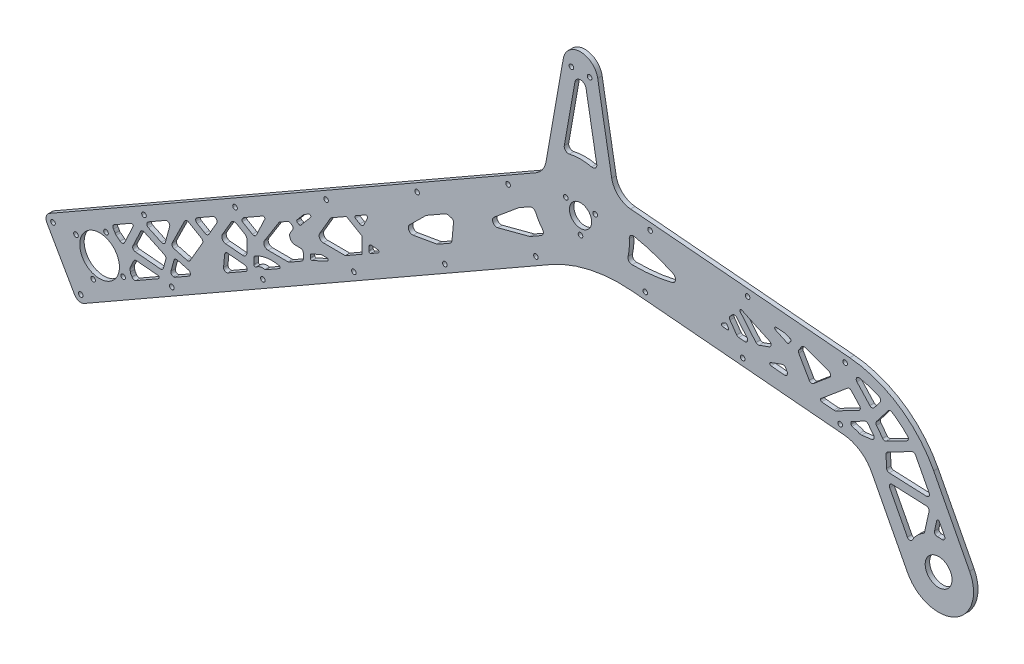
from build123d import *

# Parameters (mm, degrees)
SKETCH2_R              = 7.9375
SKETCH2_R_2            = 14.2
SKETCH2_R_3            = 1.65
SKETCH2_R_4            = 9.5885
BASE_DEPTH             = 3.175
SKETCH3_R              = 1.65
STRUT_HOLES_DEPTH      = 448.434897902
LIGHTENING_HOLES_DEPTH = 448.434897902
SKETCH7_R              = 1.65
CUT_EXTRUDE1_DEPTH     = 448.434897902


with BuildPart() as part:
    # Sketch2 → Base (new body)
    with BuildSketch(Plane.XY):
        with BuildLine():
            Line((-379.716809958, -188.506893436), (-32.006532147, 10.487277971))
            ThreePointArc((-32.006532147, 10.487277971), (-27.186230121, 14.879084252), (-24.685038782, 20.901319377))
            Line((-24.685038782, 20.901319377), (-12.310096913, 91.083102221))
            ThreePointArc((-12.310096913, 91.083102221), (0, 101.4125), (12.310096913, 91.083102221))
            Line((12.310096913, 91.083102221), (22.322003955, 34.302755831))
            ThreePointArc((22.322003955, 34.302755831), (26.960267136, 25.848318444), (35.786784109, 21.964558025))
            Line((35.786784109, 21.964558025), (192.586144941, 8.246391504))
            ThreePointArc((192.586144941, 8.246391504), (227.717231711, -4.10798993), (252.575276723, -31.83706486))
            Line((252.575276723, -31.83706486), (278.255270829, -81.167874559))
            ThreePointArc((278.255270829, -81.167874559), (267.623715331, -114.886860719), (233.904729171, -104.255305221))
            Line((233.904729171, -104.255305221), (208.224735064, -54.924495522))
            ThreePointArc((208.224735064, -54.924495522), (199.93872006, -45.681470545), (188.228357804, -41.563343401))
            Line((188.228357804, -41.563343401), (36.823729736, -28.317154839))
            ThreePointArc((36.823729736, -28.317154839), (6.649577682, -30.266109959), (-21.562664076, -41.144864173))
            Line((-21.562664076, -41.144864173), (-354.881400189, -231.902773674))
            ThreePointArc((-354.881400189, -231.902773674), (-358.677364619, -232.387866435), (-361.70452919, -230.046726627))
            Line((-361.70452919, -230.046726627), (-381.572857005, -195.330022437))
            ThreePointArc((-381.572857005, -195.330022437), (-382.057949767, -191.534058007), (-379.716809958, -188.506893436))
        make_face()
        Circle(SKETCH2_R, mode=Mode.SUBTRACT)
        with Locations((-343.92, -196.825)):
            Circle(SKETCH2_R_2, mode=Mode.SUBTRACT)
        with Locations((-6.5, 88.9125)):
            Circle(SKETCH2_R_3, mode=Mode.SUBTRACT)
        with Locations((6.5, 88.9125)):
            Circle(SKETCH2_R_3, mode=Mode.SUBTRACT)
        with Locations((256.08, -92.71158989)):
            Circle(SKETCH2_R_4, mode=Mode.SUBTRACT)
        with Locations((-360.806382749, -192.231517914)):
            Circle(SKETCH2_R_3, mode=Mode.SUBTRACT)
        with Locations((-339.326517914, -179.938617251)):
            Circle(SKETCH2_R_3, mode=Mode.SUBTRACT)
        with Locations((-327.033617251, -201.418482086)):
            Circle(SKETCH2_R_3, mode=Mode.SUBTRACT)
        with Locations((-348.513482086, -213.711382749)):
            Circle(SKETCH2_R_3, mode=Mode.SUBTRACT)
    extrude(amount=BASE_DEPTH)

    # Sketch3 → Strut Holes (cut, through all)
    with BuildSketch(Plane.XY.offset(3.175)):
        with Locations((-357.364941166, -227.56318565)):
            Circle(SKETCH3_R)
        with Locations((-292.27112081, -190.310070996)):
            Circle(SKETCH3_R)
        with Locations((-227.177300453, -153.056956343)):
            Circle(SKETCH3_R)
        with Locations((-162.083480097, -115.803841689)):
            Circle(SKETCH3_R)
        with Locations((-96.98965974, -78.550727035)):
            Circle(SKETCH3_R)
        with Locations((-31.895839384, -41.297612382)):
            Circle(SKETCH3_R)
        with Locations((-312.139448625, -155.593366806)):
            Circle(SKETCH3_R)
        with Locations((-377.233268981, -192.84648146)):
            Circle(SKETCH3_R)
        with Locations((-247.045628268, -118.340252152)):
            Circle(SKETCH3_R)
        with Locations((-181.951807912, -81.087137499)):
            Circle(SKETCH3_R)
        with Locations((-116.857987555, -43.834022845)):
            Circle(SKETCH3_R)
        with Locations((-51.764167199, -6.580908192)):
            Circle(SKETCH3_R)
        with Locations((46.269308527, -24.124436716)):
            Circle(SKETCH3_R)
        with Locations((116.002937393, -30.225338708)):
            Circle(SKETCH3_R)
        with Locations((185.73656626, -36.326240701)):
            Circle(SKETCH3_R)
        with Locations((189.222795969, 3.521547223)):
            Circle(SKETCH3_R)
        with Locations((119.489167103, 9.622449215)):
            Circle(SKETCH3_R)
        with Locations((49.755538237, 15.723351208)):
            Circle(SKETCH3_R)
    extrude(amount=-STRUT_HOLES_DEPTH, mode=Mode.SUBTRACT)

    # Sketch6 → Lightening Holes (cut, through all)
    with BuildSketch(Plane.XY.offset(3.175)):
        with BuildLine():
            Line((-317.937082153, -199.237754107), (-301.759255291, -189.979203363))
            ThreePointArc((-301.759255291, -189.979203363), (-301.27885272, -188.89855459), (-302.165025934, -188.115429161))
            Line((-302.165025934, -188.115429161), (-317.529091672, -186.71244549))
            ThreePointArc((-317.529091672, -186.71244549), (-318.704383169, -186.968323474), (-319.520360019, -187.852045956))
            Line((-319.520360019, -187.852045956), (-321.920665487, -192.94890269))
            ThreePointArc((-321.920665487, -192.94890269), (-322.086706026, -193.488507205), (-322.095332893, -194.053014132))
            ThreePointArc((-322.095332893, -194.053014132), (-321.995430567, -195.004765075), (-321.937013257, -195.959960211))
            ThreePointArc((-321.937013257, -195.959960211), (-321.816611469, -196.56901374), (-321.515239324, -197.111800643))
            ThreePointArc((-321.515239324, -197.111800643), (-321.089709213, -197.721191561), (-320.73119159, -198.372266273))
            ThreePointArc((-320.73119159, -198.372266273), (-319.522268091, -199.412366176), (-317.937082153, -199.237754107))
        make_face()
        with BuildLine():
            Line((-289.844978396, -183.160677107), (-279.93882887, -177.491399715))
            ThreePointArc((-279.93882887, -177.491399715), (-278.948378644, -175.502042811), (-280.407275879, -173.825692191))
            Line((-280.407275879, -173.825692191), (-288.292322007, -171.680779414))
            ThreePointArc((-288.292322007, -171.680779414), (-289.810707779, -171.874816518), (-290.747163702, -173.085682346))
            Line((-290.747163702, -173.085682346), (-292.868560549, -180.884280112))
            ThreePointArc((-292.868560549, -180.884280112), (-292.613471256, -182.502456625), (-291.234784363, -183.387209827))
            ThreePointArc((-291.234784363, -183.387209827), (-291.195764259, -183.393163574), (-291.156778347, -183.399337252))
            ThreePointArc((-291.156778347, -183.399337252), (-290.480404568, -183.392541824), (-289.844978396, -183.160677107))
        make_face()
        with BuildLine():
            Line((-225.068253149, -146.0890356), (-215.394271166, -140.552627413))
            ThreePointArc((-215.394271166, -140.552627413), (-214.903636001, -139.526112554), (-215.691072999, -138.704894803))
            ThreePointArc((-215.691072999, -138.704894803), (-224.321295756, -138.46558821), (-232.518295989, -141.176160044))
            ThreePointArc((-232.518295989, -141.176160044), (-233.286477009, -141.90836482), (-233.571916458, -142.930495063))
            Line((-233.571916458, -142.930495063), (-233.587977081, -147.160409637))
            ThreePointArc((-233.587977081, -147.160409637), (-232.992005427, -148.078956173), (-231.91164881, -147.900800252))
            ThreePointArc((-231.91164881, -147.900800252), (-229.043893867, -146.310414337), (-225.766503733, -146.200597789))
            ThreePointArc((-225.766503733, -146.200597789), (-225.407188584, -146.208593442), (-225.068253149, -146.0890356))
        make_face()
        with BuildLine():
            Line((-202.450189496, -105.529322903), (-201.311100417, -106.192755657))
            ThreePointArc((-201.311100417, -106.192755657), (-200.637908098, -106.314094916), (-200.044217491, -105.974326499))
            Line((-200.044217491, -105.974326499), (-193.10874934, -97.772404377))
            ThreePointArc((-193.10874934, -97.772404377), (-193.103868157, -96.486838424), (-194.369055865, -96.258795212))
            Line((-194.369055865, -96.258795212), (-197.510306407, -98.056529098))
            ThreePointArc((-197.510306407, -98.056529098), (-197.796638801, -98.255405281), (-198.044086675, -98.500981186))
            Line((-198.044086675, -98.500981186), (-202.710503229, -104.019510625))
            ThreePointArc((-202.710503229, -104.019510625), (-202.932364876, -104.835109908), (-202.450189496, -105.529322903))
        make_face()
        with BuildLine():
            Line((-333.444620565, -172.395023354), (-321.324736547, -165.45882839))
            ThreePointArc((-321.324736547, -165.45882839), (-320.149643655, -165.592039112), (-319.923331731, -166.752802359))
            Line((-319.923331731, -166.752802359), (-326.076688787, -179.818964042))
            ThreePointArc((-326.076688787, -179.818964042), (-327.489682534, -180.927174615), (-329.222241859, -180.455030372))
            ThreePointArc((-329.222241859, -180.455030372), (-330.587096563, -179.325466122), (-332.03841525, -178.309386485))
            ThreePointArc((-332.03841525, -178.309386485), (-332.502552417, -177.897052298), (-332.817881567, -177.362252973))
            ThreePointArc((-332.817881567, -177.362252973), (-333.319567754, -176.344657072), (-333.979051672, -175.421471605))
            ThreePointArc((-333.979051672, -175.421471605), (-334.420732076, -173.783065742), (-333.444620565, -172.395023354))
        make_face()
        with BuildLine():
            Line((-296.526078791, -175.281178461), (-298.296173769, -181.788333758))
            ThreePointArc((-298.296173769, -181.788333758), (-299.085121934, -182.906012266), (-300.407921189, -183.255077571))
            Line((-300.407921189, -183.255077571), (-318.426512518, -181.609693475))
            ThreePointArc((-318.426512518, -181.609693475), (-319.980472622, -180.611396672), (-320.054030653, -178.765867554))
            Line((-320.054030653, -178.765867554), (-314.587930437, -167.159040818))
            ThreePointArc((-314.587930437, -167.159040818), (-313.455436739, -166.129184627), (-311.926424469, -166.201760304))
            Line((-311.926424469, -166.201760304), (-297.603838378, -172.946815839))
            ThreePointArc((-297.603838378, -172.946815839), (-296.64013933, -173.917860945), (-296.526078791, -175.281178461))
        make_face()
        with BuildLine():
            Line((-296.725202345, -151.380544722), (-309.162121937, -158.49817876))
            ThreePointArc((-309.162121937, -158.49817876), (-310.167118822, -160.31366557), (-309.020818273, -162.043407211))
            Line((-309.020818273, -162.043407211), (-299.712508239, -166.427047688))
            ThreePointArc((-299.712508239, -166.427047688), (-298.022047377, -166.433466223), (-296.930523197, -165.142623828))
            Line((-296.930523197, -165.142623828), (-293.80191364, -153.641349312))
            ThreePointArc((-293.80191364, -153.641349312), (-294.508247327, -151.534307484), (-296.725202345, -151.380544722))
        make_face()
        with BuildLine():
            Line((-290.749203903, -165.830761417), (-281.418682259, -168.368876575))
            ThreePointArc((-281.418682259, -168.368876575), (-280.135367262, -168.289656018), (-279.165471442, -167.445573454))
            Line((-279.165471442, -167.445573454), (-270.334962051, -152.283921043))
            ThreePointArc((-270.334962051, -152.283921043), (-270.129400346, -150.767052513), (-271.056634293, -149.549110414))
            Line((-271.056634293, -149.549110414), (-280.339031078, -144.142820271))
            ThreePointArc((-280.339031078, -144.142820271), (-281.923077504, -143.956245777), (-283.139846515, -144.987500494))
            Line((-283.139846515, -144.987500494), (-292.018480766, -163.01732789))
            ThreePointArc((-292.018480766, -163.01732789), (-292.047293032, -164.72335957), (-290.749203903, -165.830761417))
        make_face()
        with BuildLine():
            Line((-274.174863713, -138.475013199), (-262.829621171, -131.982144615))
            ThreePointArc((-262.829621171, -131.982144615), (-260.416631803, -132.309146065), (-260.107963345, -134.724549018))
            Line((-260.107963345, -134.724549018), (-265.805400683, -144.506834582))
            ThreePointArc((-265.805400683, -144.506834582), (-267.023342782, -145.43406853), (-268.540211311, -145.228506825))
            Line((-268.540211311, -145.228506825), (-274.188016515, -141.939089844))
            ThreePointArc((-274.188016515, -141.939089844), (-275.181432906, -140.203254635), (-274.174863713, -138.475013199))
        make_face()
        with BuildLine():
            Line((-255.261313261, -159.742391016), (-254.488576255, -151.280152708))
            ThreePointArc((-254.488576255, -151.280152708), (-253.776611846, -149.925068788), (-252.314987955, -149.470314621))
            Line((-252.314987955, -149.470314621), (-240.229659184, -150.573897437))
            ThreePointArc((-240.229659184, -150.573897437), (-238.457312757, -152.140148294), (-239.418117899, -154.30144584))
            Line((-239.418117899, -154.30144584), (-252.276183677, -161.660101332))
            ThreePointArc((-252.276183677, -161.660101332), (-254.350596062, -161.606956723), (-255.261313261, -159.742391016))
        make_face()
        with BuildLine():
            Line((-249.949142761, -129.20392042), (-256.129617611, -139.815563221))
            ThreePointArc((-256.129617611, -139.815563221), (-256.203528398, -142.700549226), (-253.810068117, -144.312986801))
            Line((-253.810068117, -144.312986801), (-241.842841701, -145.405784992))
            ThreePointArc((-241.842841701, -145.405784992), (-239.551671104, -144.637726688), (-238.570050666, -142.429605863))
            Line((-238.570050666, -142.429605863), (-238.538476633, -134.113897012))
            ThreePointArc((-238.538476633, -134.113897012), (-238.934702194, -132.612381765), (-240.028601219, -131.510144198))
            Line((-240.028601219, -131.510144198), (-245.846926818, -128.121412056))
            ThreePointArc((-245.846926818, -128.121412056), (-248.122229612, -127.813069499), (-249.949142761, -129.20392042))
        make_face()
        with BuildLine():
            Line((-241.753564235, -124.719255848), (-234.63976684, -128.862501783))
            ThreePointArc((-234.63976684, -128.862501783), (-233.039032694, -129.043963991), (-231.823804406, -127.986373074))
            Line((-231.823804406, -127.986373074), (-225.796901327, -115.1887263))
            ThreePointArc((-225.796901327, -115.1887263), (-226.023213251, -114.027963054), (-227.198306143, -113.894752332))
            Line((-227.198306143, -113.894752332), (-240.486863137, -121.499777426))
            ThreePointArc((-240.486863137, -121.499777426), (-240.868014227, -121.782834524), (-241.171709307, -122.147754751))
            ThreePointArc((-241.171709307, -122.147754751), (-241.549582312, -122.675396768), (-241.974698217, -123.165774758))
            ThreePointArc((-241.974698217, -123.165774758), (-242.240299662, -123.996061899), (-241.753564235, -124.719255848))
        make_face()
        with BuildLine():
            Line((-215.700125094, -112.192821254), (-226.032975591, -128.589971196))
            ThreePointArc((-226.032975591, -128.589971196), (-226.124248281, -131.633833238), (-223.506276432, -133.189355733))
            Line((-223.506276432, -133.189355733), (-209.202252691, -133.243666885))
            ThreePointArc((-209.202252691, -133.243666885), (-208.68435958, -133.177484442), (-208.201242526, -132.979516511))
            Line((-208.201242526, -132.979516511), (-199.253531837, -127.858752507))
            ThreePointArc((-199.253531837, -127.858752507), (-198.518706793, -127.12948649), (-198.246962645, -126.130511071))
            Line((-198.246962645, -126.130511071), (-198.232362286, -122.28518887))
            ThreePointArc((-198.232362286, -122.28518887), (-198.812774892, -120.868761336), (-200.224754096, -120.277609512))
            Line((-200.224754096, -120.277609512), (-204.008629507, -120.263242462))
            ThreePointArc((-204.008629507, -120.263242462), (-207.499258639, -118.189212469), (-207.377561718, -114.130729746))
            Line((-207.377561718, -114.130729746), (-205.861080411, -111.724232972))
            ThreePointArc((-205.861080411, -111.724232972), (-205.610725726, -110.181490101), (-206.546571097, -108.929720762))
            Line((-206.546571097, -108.929720762), (-207.493132435, -108.378420775))
            ThreePointArc((-207.493132435, -108.378420775), (-208.492107854, -108.106676627), (-209.493118019, -108.370827001))
            Line((-209.493118019, -108.370827001), (-215.001481605, -111.523256819))
            ThreePointArc((-215.001481605, -111.523256819), (-215.391909437, -111.815147719), (-215.700125094, -112.192821254))
        make_face()
        with BuildLine():
            Line((-193.227653511, -121.054522852), (-193.234462366, -122.84778292))
            ThreePointArc((-193.234462366, -122.84778292), (-192.774967571, -123.692925108), (-191.815295507, -123.759485695))
            Line((-191.815295507, -123.759485695), (-180.993415111, -118.763096002))
            ThreePointArc((-180.993415111, -118.763096002), (-180.435478412, -117.642458946), (-181.408792291, -116.855197322))
            Line((-181.408792291, -116.855197322), (-185.032757855, -116.841437436))
            ThreePointArc((-185.032757855, -116.841437436), (-185.465813965, -116.887201486), (-185.878699763, -117.025611243))
            Line((-185.878699763, -117.025611243), (-192.646834787, -120.150413851))
            ThreePointArc((-192.646834787, -120.150413851), (-193.06900602, -120.517821741), (-193.227653511, -121.054522852))
        make_face()
        with BuildLine():
            Line((-168.149004332, -108.905485935), (-183.952737992, -108.845480513))
            ThreePointArc((-183.952737992, -108.845480513), (-186.545100145, -107.335626723), (-186.533709485, -104.335648348))
            Line((-186.533709485, -104.335648348), (-178.579876435, -90.679216235))
            Line((-178.579876435, -90.679216235), (-167.386832198, -84.273450557))
            Line((-167.386832198, -84.273450557), (-156.388373523, -90.679216235))
            Line((-156.388373523, -90.679216235), (-156.432116668, -102.199925297))
            Line((-156.432116668, -102.199925297), (-168.149004332, -108.905485935))
        make_face()
        with BuildLine():
            Line((-151.414615639, -97.600140871), (-151.405431829, -95.181384659))
            ThreePointArc((-151.405431829, -95.181384659), (-150.751018204, -93.709304109), (-149.223571139, -93.197265239))
            Line((-149.223571139, -93.197265239), (-145.032551994, -93.579971974))
            ThreePointArc((-145.032551994, -93.579971974), (-144.146378781, -94.363097402), (-144.626781352, -95.443746175))
            Line((-144.626781352, -95.443746175), (-149.917914652, -98.471855363))
            ThreePointArc((-149.917914652, -98.471855363), (-150.917907444, -98.468058476), (-151.414615639, -97.600140871))
        make_face()
        with BuildLine():
            Line((-160.872630183, -80.545380623), (-153.761861304, -76.475896195))
            ThreePointArc((-153.761861304, -76.475896195), (-152.586768412, -76.609106917), (-152.360456488, -77.769870163))
            Line((-152.360456488, -77.769870163), (-154.930028199, -83.226150228))
            ThreePointArc((-154.930028199, -83.226150228), (-156.145256487, -84.283741145), (-157.745990633, -84.102278936))
            Line((-157.745990633, -84.102278936), (-160.879206584, -82.277418946))
            ThreePointArc((-160.879206584, -82.277418946), (-161.375914779, -81.409501341), (-160.872630183, -80.545380623))
        make_face()
        with BuildLine():
            Line((-90.819864813, -49.698540482), (-91.896421351, -61.487904644))
            ThreePointArc((-91.896421351, -61.487904644), (-92.359955239, -62.836585977), (-93.393866555, -63.818844799))
            Line((-93.393866555, -63.818844799), (-101.994338017, -68.740884214))
            ThreePointArc((-101.994338017, -68.740884214), (-102.469113289, -68.960084777), (-102.974739436, -69.09351133))
            Line((-102.974739436, -69.09351133), (-119.629879497, -71.965101226))
            ThreePointArc((-119.629879497, -71.965101226), (-122.805875604, -70.383853511), (-122.252853304, -66.87936183))
            Line((-122.252853304, -66.87936183), (-110.681116507, -55.395166432))
            ThreePointArc((-110.681116507, -55.395166432), (-110.385100172, -55.137548838), (-110.057990454, -54.920773084))
            Line((-110.057990454, -54.920773084), (-96.724691463, -47.290142199))
            ThreePointArc((-96.724691463, -47.290142199), (-95.614849419, -46.918095089), (-94.447112805, -46.999086542))
            Line((-94.447112805, -46.999086542), (-92.286608626, -47.586793062))
            ThreePointArc((-92.286608626, -47.586793062), (-91.168930118, -48.375741228), (-90.819864813, -49.698540482))
        make_face()
        with BuildLine():
            Line((-28.096781534, -26.449402024), (-35.825401618, -30.87248195))
            ThreePointArc((-35.825401618, -30.87248195), (-36.178007781, -31.044706772), (-36.550077199, -31.169433846))
            Line((-36.550077199, -31.169433846), (-59.133973609, -37.128958431))
            ThreePointArc((-59.133973609, -37.128958431), (-62.565695554, -35.603385935), (-61.819045791, -31.92281518))
            Line((-61.819045791, -31.92281518), (-44.317223042, -17.349924163))
            ThreePointArc((-44.317223042, -17.349924163), (-44.108986088, -17.191390869), (-43.887724451, -17.051609889))
            Line((-43.887724451, -17.051609889), (-36.274597881, -12.694626761))
            ThreePointArc((-36.274597881, -12.694626761), (-33.845543285, -12.449097133), (-32.038330666, -14.090612767))
            ThreePointArc((-32.038330666, -14.090612767), (-29.904900702, -18.185073934), (-27.251097742, -21.963097956))
            ThreePointArc((-27.251097742, -21.963097956), (-26.638826778, -24.401372335), (-28.096781534, -26.449402024))
        make_face()
        with BuildLine():
            Line((-11.599665343, 37.524455033), (-3.986146646, 80.702865203))
            ThreePointArc((-3.986146646, 80.702865203), (0, 84.047639383), (3.986146646, 80.702865203))
            Line((3.986146646, 80.702865203), (11.599665343, 37.524455033))
            ThreePointArc((11.599665343, 37.524455033), (10.707449692, 34.824680589), (7.962722972, 34.082180723))
            ThreePointArc((7.962722972, 34.082180723), (0, 35), (-7.962722972, 34.082180723))
            ThreePointArc((-7.962722972, 34.082180723), (-10.707449692, 34.824680589), (-11.599665343, 37.524455033))
        make_face()
        with BuildLine():
            Line((246.075987756, -72.913561708), (249.254007124, -58.57844272))
            ThreePointArc((249.254007124, -58.57844272), (248.888121791, -56.928040634), (247.388653885, -56.147467049))
            Line((247.388653885, -56.147467049), (222.962162816, -55.080983417))
            ThreePointArc((222.962162816, -55.080983417), (221.188141149, -56.004480644), (221.100902375, -58.002577087))
            Line((221.100902375, -58.002577087), (233.735290203, -82.273010289))
            ThreePointArc((233.735290203, -82.273010289), (235.484637714, -83.349360854), (237.260008731, -82.316498325))
            ThreePointArc((237.260008731, -82.316498325), (240.657318696, -77.731906936), (245.140979083, -74.202461834))
            ThreePointArc((245.140979083, -74.202461834), (245.742284649, -73.655075389), (246.075987756, -72.913561708))
        make_face()
        with BuildLine():
            Line((253.133679234, -68.799730633), (254.751992566, -61.499990928))
            ThreePointArc((254.751992566, -61.499990928), (255.597762381, -60.72498568), (256.615299406, -61.254681929))
            Line((256.615299406, -61.254681929), (260.345615198, -68.420551892))
            ThreePointArc((260.345615198, -68.420551892), (260.223925452, -70.470902803), (258.359543018, -71.332775993))
            ThreePointArc((258.359543018, -71.332775993), (256.767087179, -71.222571503), (255.170843908, -71.230820928))
            ThreePointArc((255.170843908, -71.230820928), (253.553325039, -70.51716267), (253.133679234, -68.799730633))
        make_face()
        with BuildLine():
            Line((249.310771487, -47.22281435), (239.59747458, -28.563744597))
            ThreePointArc((239.59747458, -28.563744597), (238.424864512, -27.579807922), (236.899955687, -27.713220157))
            Line((236.899955687, -27.713220157), (219.565597936, -36.736915644))
            ThreePointArc((219.565597936, -36.736915644), (218.757044355, -37.510937311), (218.490998719, -38.598176086))
            Line((218.490998719, -38.598176086), (218.860832904, -47.068771554))
            ThreePointArc((218.860832904, -47.068771554), (219.444715785, -48.395746342), (220.771690573, -48.979629223))
            Line((220.771690573, -48.979629223), (247.449511046, -50.144408019))
            ThreePointArc((247.449511046, -50.144408019), (249.223532712, -49.220910793), (249.310771487, -47.22281435))
        make_face()
        with BuildLine():
            Line((233.413458883, -22.763883833), (218.618137266, -30.46584077))
            ThreePointArc((218.618137266, -30.46584077), (217.261760811, -30.644411118), (216.107933359, -29.909341962))
            Line((216.107933359, -29.909341962), (211.671799483, -24.128059737))
            ThreePointArc((211.671799483, -24.128059737), (211.258506163, -22.910536879), (211.671799483, -21.693014021))
            Line((211.671799483, -21.693014021), (220.007167815, -10.830150518))
            ThreePointArc((220.007167815, -10.830150518), (221.257760997, -10.076118732), (222.687548657, -10.3731953))
            ThreePointArc((222.687548657, -10.3731953), (228.553817552, -14.676513168), (233.918900039, -19.590528361))
            ThreePointArc((233.918900039, -19.590528361), (234.465065341, -21.304449895), (233.413458883, -22.763883833))
        make_face()
        with BuildLine():
            Line((209.61657846, -31.305721344), (205.746256457, -26.261819508))
            ThreePointArc((205.746256457, -26.261819508), (204.592429004, -25.526750352), (203.23605255, -25.7053207))
            Line((203.23605255, -25.7053207), (194.010059092, -30.508068903))
            ThreePointArc((194.010059092, -30.508068903), (193.616895834, -30.876306478), (193.471807705, -31.395079736))
            Line((193.471807705, -31.395079736), (193.471807705, -32.496691451))
            ThreePointArc((193.471807705, -32.496691451), (193.684204256, -33.112873898), (194.23116932, -33.467306291))
            ThreePointArc((194.23116932, -33.467306291), (196.89746606, -34.245224393), (199.491371204, -35.238175037))
            ThreePointArc((199.491371204, -35.238175037), (200.2654041, -35.454155852), (201.069000396, -35.456918226))
            Line((201.069000396, -35.456918226), (208.290924164, -34.506133925))
            ThreePointArc((208.290924164, -34.506133925), (209.877630844, -33.288611067), (209.61657846, -31.305721344))
        make_face()
        with BuildLine():
            Line((214.303083467, -8.407780179), (209.957683706, -14.070815403))
            ThreePointArc((209.957683706, -14.070815403), (208.4582158, -14.851388988), (206.896422352, -14.20447296))
            Line((206.896422352, -14.20447296), (197.688681904, -4.155987535))
            ThreePointArc((197.688681904, -4.155987535), (197.423723958, -1.817844179), (199.566737265, -0.845933158))
            ThreePointArc((199.566737265, -0.845933158), (206.676023639, -2.722269436), (213.536897173, -5.366320289))
            ThreePointArc((213.536897173, -5.366320289), (214.655785228, -6.701693203), (214.303083467, -8.407780179))
        make_face()
        with BuildLine():
            Line((193.681402215, -11.624307007), (199.545514004, -18.023862053))
            ThreePointArc((199.545514004, -18.023862053), (200.040574836, -19.722338824), (198.994456557, -21.149064135))
            Line((198.994456557, -21.149064135), (182.807531418, -29.575444012))
            ThreePointArc((182.807531418, -29.575444012), (182.007556544, -29.856767353), (181.16081835, -29.902995606))
            Line((181.16081835, -29.902995606), (172.48260155, -29.143750017))
            ThreePointArc((172.48260155, -29.143750017), (171.616040342, -28.448261118), (171.926969683, -27.381510875))
            Line((171.926969683, -27.381510875), (190.921272322, -11.443398536))
            ThreePointArc((190.921272322, -11.443398536), (192.3376538, -10.979769576), (193.681402215, -11.624307007))
        make_face()
        with BuildLine():
            Line((178.199205815, -11.022517891), (166.591800736, -20.762287211))
            ThreePointArc((166.591800736, -20.762287211), (164.958929162, -21.199813831), (163.574174709, -20.230198325))
            Line((163.574174709, -20.230198325), (156.047951006, -7.194396481))
            ThreePointArc((156.047951006, -7.194396481), (155.78190537, -6.107157706), (156.141697725, -5.047243608))
            Line((156.141697725, -5.047243608), (158.18845934, -2.124165087))
            ThreePointArc((158.18845934, -2.124165087), (159.22535183, -1.363884058), (160.510803716, -1.391932718))
            Line((160.510803716, -1.391932718), (177.597670882, -7.611043763))
            ThreePointArc((177.597670882, -7.611043763), (178.883246101, -9.143132649), (178.199205815, -11.022517891))
        make_face()
        with BuildLine():
            Line((146.644806866, -20.907673079), (147.746965574, -22.816667961))
            ThreePointArc((147.746965574, -22.816667961), (147.701697658, -24.891267177), (145.840603281, -25.809057357))
            Line((145.840603281, -25.809057357), (136.229987031, -24.968237386))
            ThreePointArc((136.229987031, -24.968237386), (135.325697913, -24.10256888), (135.975122631, -23.032350067))
            Line((135.975122631, -23.032350067), (144.228715771, -20.028287838))
            ThreePointArc((144.228715771, -20.028287838), (145.596796345, -20.028287838), (146.644806866, -20.907673079))
        make_face()
        with BuildLine():
            Line((134.974345297, -13.819003275), (127.671845659, -16.476895779))
            ThreePointArc((127.671845659, -16.476895779), (126.470167282, -16.52936219), (125.455716486, -15.883085757))
            Line((125.455716486, -15.883085757), (114.198527576, -2.46729043))
            ThreePointArc((114.198527576, -2.46729043), (114.171218678, -1.215741392), (115.387190281, -0.918195034))
            Line((115.387190281, -0.918195034), (135.135541534, -10.127002459))
            ThreePointArc((135.135541534, -10.127002459), (136.288401454, -12.026856808), (134.974345297, -13.819003275))
        make_face()
        with BuildLine():
            Line((139.430597275, -1.096040654), (147.83182135, -5.013595778))
            ThreePointArc((147.83182135, -5.013595778), (148.513258657, -5.073213817), (149.073591656, -4.680864427))
            Line((149.073591656, -4.680864427), (150.425898479, -2.749570135))
            ThreePointArc((150.425898479, -2.749570135), (150.560463385, -1.875287899), (149.948766578, -1.236301077))
            Line((149.948766578, -1.236301077), (146.098496258, 0.165082713))
            ThreePointArc((146.098496258, 0.165082713), (145.72175467, 0.274892872), (145.333903056, 0.334588945))
            Line((145.333903056, 0.334588945), (139.940371279, 0.806461832))
            ThreePointArc((139.940371279, 0.806461832), (138.88728971, 0.069086179), (139.430597275, -1.096040654))
        make_face()
        with BuildLine():
            Line((111.660494937, -7.221200049), (119.04545342, -16.022250853))
            ThreePointArc((119.04545342, -16.022250853), (119.2873862, -18.231323299), (117.339053048, -19.300215468))
            Line((117.339053048, -19.300215468), (113.116226003, -18.930765974))
            ThreePointArc((113.116226003, -18.930765974), (112.290537488, -18.670427385), (111.6522334, -18.08552945))
            Line((111.6522334, -18.08552945), (106.877510971, -11.266519132))
            ThreePointArc((106.877510971, -11.266519132), (106.523425664, -9.945054773), (107.101601497, -8.705152697))
            Line((107.101601497, -8.705152697), (108.714192488, -7.092561706))
            ThreePointArc((108.714192488, -7.092561706), (110.215644825, -6.508678825), (111.660494937, -7.221200049))
        make_face()
        with BuildLine():
            Line((104.703890017, -15.136053881), (105.75536165, -16.637710998))
            ThreePointArc((105.75536165, -16.637710998), (105.80223501, -17.711287434), (104.849053863, -18.207482132))
            Line((104.849053863, -18.207482132), (101.67727128, -17.929987113))
            ThreePointArc((101.67727128, -17.929987113), (100.788131016, -17.150232029), (101.264427023, -16.067767011))
            Line((101.264427023, -16.067767011), (103.384737973, -14.843604914))
            ThreePointArc((103.384737973, -14.843604914), (104.101177587, -14.73333431), (104.703890017, -15.136053881))
        make_face()
        with BuildLine():
            ThreePointArc((34.863622447, 3.086718303), (34.900341082, -2.63935454), (34.002891304, -8.294780463))
            ThreePointArc((34.002891304, -8.294780463), (34.552114447, -10.851108963), (36.89804352, -12.005699039))
            ThreePointArc((36.89804352, -12.005699039), (51.290024205, -11.233136631), (65.485577957, -8.740705208))
            ThreePointArc((65.485577957, -8.740705208), (67.910545504, -5.973310403), (66.09771963, -2.77134164))
            ThreePointArc((66.09771963, -2.77134164), (52.541526947, 2.603547383), (38.433463256, 6.29439159))
            ThreePointArc((38.433463256, 6.29439159), (35.846829531, 5.582787002), (34.863622447, 3.086718303))
        make_face()
    extrude(amount=-LIGHTENING_HOLES_DEPTH, mode=Mode.SUBTRACT)

    # Sketch7 → Cut-Extrude1 (cut, through all)
    with BuildSketch(Plane.XY.offset(3.175)):
        with Locations((-10.5, 6.062177826)):
            Circle(SKETCH7_R)
        with Locations((10.5, 6.062177826)):
            Circle(SKETCH7_R)
        with Locations((0, -12.124355653)):
            Circle(SKETCH7_R)
    extrude(amount=-CUT_EXTRUDE1_DEPTH, mode=Mode.SUBTRACT)


solid = part.part
